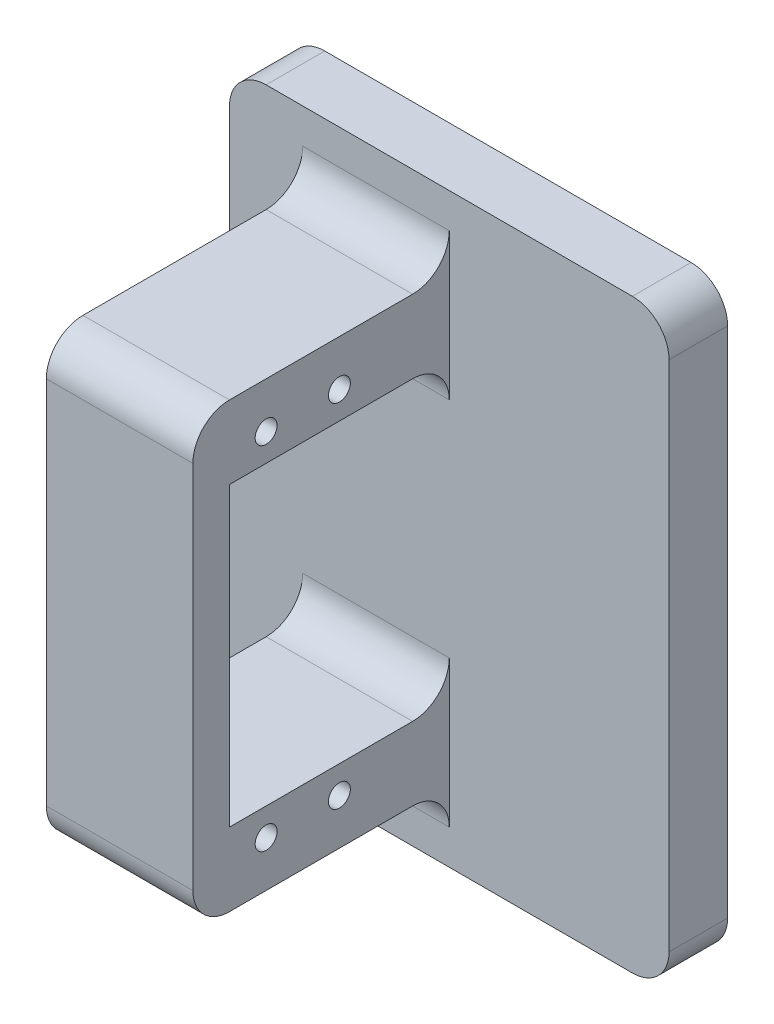
from build123d import *

# Parameters (mm, degrees)
BOSS_EXTRUDE1_DEPTH = 8
CUT_EXTRUDE3_DEPTH  = 3
BOSS_EXTRUDE4_START = 9
SKETCH10_R          = 9.75
BOSS_EXTRUDE4_DEPTH = 9
BOSS_EXTRUDE5_DEPTH = 20
FILLET1_R           = 5
SKETCH13_R          = 1.5
CUT_EXTRUDE4_DEPTH  = 10


with BuildPart() as part:
    # Sketch3 → Boss-Extrude1 (new body)
    with BuildSketch(Plane(origin=(0, 0, 30), x_dir=(-1, 0, 0), z_dir=(0, 0, -1))):
        with BuildLine():
            Line((55, 53.257283518), (105, 53.257283518))
            ThreePointArc((105, 53.257283518), (108.535533906, 51.792817424), (110, 48.257283518))
            Line((110, 48.257283518), (110, -21.742716482))
            ThreePointArc((110, -21.742716482), (108.535533906, -25.278250388), (105, -26.742716482))
            Line((105, -26.742716482), (55, -26.742716482))
            ThreePointArc((55, -26.742716482), (51.464466094, -25.278250388), (50, -21.742716482))
            Line((50, -21.742716482), (50, 48.257283518))
            ThreePointArc((50, 48.257283518), (51.464466094, 51.792817424), (55, 53.257283518))
        make_face()
    extrude(amount=BOSS_EXTRUDE1_DEPTH)

    # Sketch8 → Cut-Extrude3 (cut)
    with BuildSketch(Plane(origin=(0, 0, 22), x_dir=(-1, 0, 0), z_dir=(0, 0, -1))):
        with BuildLine():
            Line((78.25, 15.378603862), (78.25, 11.135963175))
            ThreePointArc((78.25, 11.135963175), (80, 10.507283518), (81.75, 11.135963175))
            Line((81.75, 11.135963175), (81.75, 15.378603862))
            ThreePointArc((81.75, 15.378603862), (80, 16.007283518), (78.25, 15.378603862))
        make_face()
    extrude(amount=-CUT_EXTRUDE3_DEPTH, mode=Mode.SUBTRACT)

    # Sketch10 → Boss-Extrude4 (add)
    with BuildSketch(Plane(origin=(0, 0, 22), x_dir=(-1, 0, 0), z_dir=(0, 0, -1)).offset(BOSS_EXTRUDE4_START)):
        with Locations((80, 13.257283518)):
            Circle(SKETCH10_R)
        with BuildLine():
            Line((81.75, 11.135963175), (81.75, 15.378603862))
            ThreePointArc((81.75, 15.378603862), (80, 16.007283518), (78.25, 15.378603862))
            Line((78.25, 15.378603862), (78.25, 11.135963175))
            ThreePointArc((78.25, 11.135963175), (80, 10.507283518), (81.75, 11.135963175))
        make_face(mode=Mode.SUBTRACT)
    extrude(amount=-BOSS_EXTRUDE4_DEPTH)

    # Sketch12 → Boss-Extrude5 (add)
    with BuildSketch(Plane.ZY.offset(80)):
        Polygon((60, -6.992716482), (30, -6.992716482), (30, -16.992716482), (65, -16.992716482), (65, 43.507283518), (30, 43.507283518), (30, 33.507283518), (60, 33.507283518), align=None)
    extrude(amount=BOSS_EXTRUDE5_DEPTH)

    # Fillet1
    fillet1_edges = [part.edges().sort_by_distance(p)[0] for p in [
        (-90, -16.992716482, 30),
        (-90, -6.992716482, 30),
        (-90, 33.507283518, 30),
        (-90, 43.507283518, 30),
        (-90, 43.507283518, 65),
        (-90, -16.992716482, 65),
    ]]
    fillet(fillet1_edges, radius=FILLET1_R)

    # Sketch13 → Cut-Extrude4 (cut)
    with BuildSketch(Plane(origin=(-80, 0, 0), x_dir=(0, 0, -1), z_dir=(1, 0, 0))):
        with Locations((-55, -10.742716482)):
            Circle(SKETCH13_R)
        with Locations((-45, -10.742716482)):
            Circle(SKETCH13_R)
        with Locations((-55, 37.257283518)):
            Circle(SKETCH13_R)
        with Locations((-45, 37.257283518)):
            Circle(SKETCH13_R)
    extrude(amount=-CUT_EXTRUDE4_DEPTH, mode=Mode.SUBTRACT)


solid = part.part
